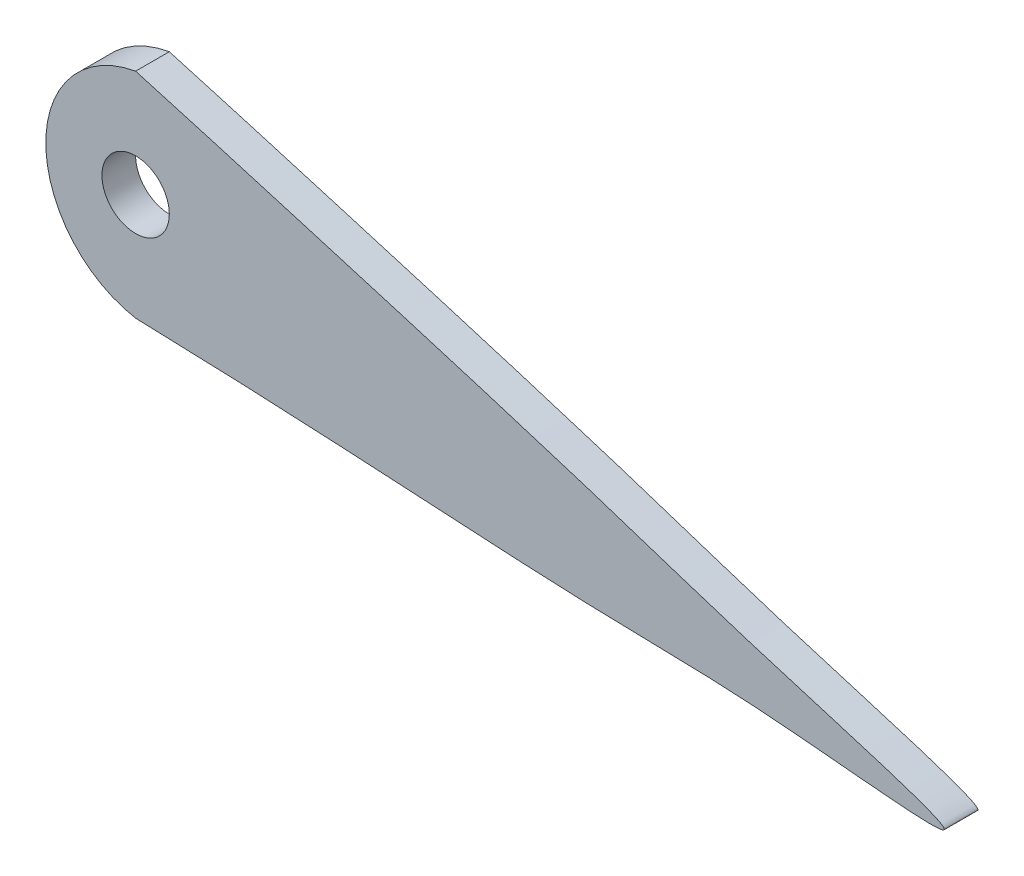
from build123d import *

# Parameters (mm, degrees)
SKETCH1_R                      = 9.525
SKETCH1_R_2                    = 3.175
BOSS_EXTRUDE1_DEPTH            = 3.175
CUT_EXTRUDE1_DEPTH             = 83.312
CUT_EXTRUDE2_DEPTH             = 41.720661094
CUT_EXTRUDE3_DEPTH             = 41.720661094
CUT_EXTRUDE5_DEPTH             = 3.175
BODY_DELETE_KEEP_1_OUTLINE_R   = 9.525
BODY_DELETE_KEEP_1_OUTLINE_R_2 = 3.175
BODY_DELETE_KEEP_1_DEPTH       = 3.175
CUT_EXTRUDE_THIN1_DEPTH        = 306.750045716
CUT_EXTRUDE_THIN1_DEPTH_BACK   = 306.750045716
SKETCH5_W                      = 2.54
SKETCH5_H                      = 35.939370043


# Read off the part's stored shape, not the designer's step: Cut-Extrude5, Body-Delete/Keep 1
with BuildPart() as part:
    # Sketch1 → Boss-Extrude1 (new body)
    with BuildSketch(Plane.XY):
        with BuildLine():
            add(Edge.make_bspline(
                [(304.8, 0), (305.077640245, 0.670235949), (287.206651558, 5.720143468), (270.662795429, 11.397054489), (243.463273842, 19.4859206), (213.747912645, 28.209957225), (183.040246216, 34.676594881), (152.491946525, 38.62898995), (121.966980877, 41.172895409), (91.414928066, 41.723012749), (65.927495496, 40.062013506), (45.625003822, 37.00459991), (32.727710355, 34.352142796), (22.731795616, 30.196529044), (14.907225707, 26.461250588), (8.516283527, 21.964417846), (2.537455581, 16.488464455), (-1.964479894, 8.893906893), (2.841930098, 2.334923028), (8.778829491, 0.629027732), (15.228793663, 0.221834685), (22.863576464, 0.239109806), (33.015631673, 0.788100742), (45.740419078, 0.855312608), (66.018396979, 2.65839435), (91.426578086, 3.794926314), (121.91527013, 4.332217391), (152.40834867, 4.479066808), (182.849810214, 4.269103649), (213.479164171, 4.047670271), (243.430144592, 3.313971789), (270.486497521, 1.370513613), (287.394329759, 1.442404027), (304.536665057, -0.635702313), (304.8, 0)],
                knots=[0, 0, 0, 0, 0.025556044, 0.050960447, 0.101552747, 0.151805438, 0.201252492, 0.250083002, 0.298629141, 0.347026117, 0.395536064, 0.420002519, 0.444885368, 0.457915187, 0.471441031, 0.48620838, 0.494593531, 0.510948222, 0.521394631, 0.527823606, 0.539981828, 0.552079711, 0.564187269, 0.588393921, 0.612648894, 0.661100879, 0.709502089, 0.757894227, 0.806286364, 0.854680317, 0.903093621, 0.951545605, 0.97576072, 1, 1, 1, 1], degree=3))
        make_face()
        with Locations((82.55, 21.412200012)):
            Circle(SKETCH1_R, mode=Mode.SUBTRACT)
        with Locations((152.4, 21.412200012)):
            Circle(SKETCH1_R_2, mode=Mode.SUBTRACT)
        with Locations((228.6, 13.713637845)):
            Circle(SKETCH1_R_2, mode=Mode.SUBTRACT)
    extrude(amount=BOSS_EXTRUDE1_DEPTH)

    # Sketch2 → Cut-Extrude1 (cut)
    with BuildSketch(Plane.XY.offset(3.175)):
        with BuildLine():
            Line((107.95, 32.461200012), (133.35, 32.461200012))
            ThreePointArc((133.35, 32.461200012), (144.399, 21.412200012), (133.35, 10.363200012))
            Line((133.35, 10.363200012), (107.95, 10.363200012))
            ThreePointArc((107.95, 10.363200012), (96.901, 21.412200012), (107.95, 32.461200012))
        make_face()
    extrude(amount=-CUT_EXTRUDE1_DEPTH, mode=Mode.SUBTRACT)

    # Sketch2<3> → Cut-Extrude2 (cut)
    with BuildSketch(Plane.XY.offset(3.175)):
        with BuildLine():
            Line((54.120617908, 7.858599468), (19.13723729, 7.396211684))
            ThreePointArc((19.13723729, 7.396211684), (12.206581412, 13.227292952), (16.97145499, 20.929985952))
            Line((16.97145499, 20.929985952), (50.35209489, 31.407752975))
            ThreePointArc((50.35209489, 31.407752975), (65.861602224, 21.813596528), (54.120617908, 7.858599468))
        make_face()
    extrude(amount=-CUT_EXTRUDE2_DEPTH, mode=Mode.SUBTRACT)

    # Sketch2<4> → Cut-Extrude3 (cut)
    with BuildSketch(Plane.XY.offset(3.175)):
        with BuildLine():
            Line((177.575712719, 31.649714976), (211.50265303, 23.10492457))
            ThreePointArc((211.50265303, 23.10492457), (217.464748261, 14.906681868), (210.11714063, 7.923099332))
            Line((210.11714063, 7.923099332), (175.164881599, 7.923099332))
            ThreePointArc((175.164881599, 7.923099332), (162.64237396, 21.181283902), (177.575712719, 31.649714976))
        make_face()
    extrude(amount=-CUT_EXTRUDE3_DEPTH, mode=Mode.SUBTRACT)

    # Cut-Extrude5 outline → Cut-Extrude5 (cut)
    with BuildSketch(Plane.XY):
        with BuildLine():
            add(Edge.make_bspline(
                [(219.855455249, 3.846240006), (222.76607486, 3.787240674), (225.676636253, 3.717870705), (228.6, 3.633767698)],
                knots=[0.865078344, 0.865078344, 0.865078344, 0.865078344, 0.879068023, 0.879068023, 0.879068023, 0.879068023], degree=3))
            ThreePointArc((228.6, 3.633767698), (220.136164742, 13.713637845), (228.6, 23.793507992))
            add(Edge.make_bspline(
                [(228.6, 23.793507992), (225.681425259, 24.620808401), (222.771978735, 25.426534387), (219.855455249, 26.205464415)],
                knots=[0.126545277, 0.126545277, 0.126545277, 0.126545277, 0.141060167, 0.141060167, 0.141060167, 0.141060167], degree=3))
            Line((219.855455249, 26.205464415), (219.855455249, 3.846240006))
        make_face()
    extrude(amount=CUT_EXTRUDE5_DEPTH, mode=Mode.SUBTRACT)

    # Body-Delete/Keep 1 outline → Body-Delete/Keep 1 (cut)
    with BuildSketch(Plane.XY):
        with BuildLine():
            Line((219.855455249, 3.846240006), (219.855455249, 26.205464415))
            add(Edge.make_bspline(
                [(219.855455249, 26.205464415), (217.696373423, 26.782100836), (205.580009963, 29.93001196), (183.040246216, 34.676594881), (152.491946525, 38.62898995), (121.966980877, 41.172895409), (91.414928066, 41.723012749), (65.927495496, 40.062013506), (45.625003822, 37.00459991), (32.727710355, 34.352142796), (22.731795616, 30.196529044), (14.907225707, 26.461250588), (8.516283527, 21.964417846), (2.537455581, 16.488464455), (-1.964479894, 8.893906893), (2.841930098, 2.334923028), (8.778829491, 0.629027732), (15.228793663, 0.221834685), (22.863576464, 0.239109806), (33.015631673, 0.788100742), (45.740419078, 0.855312608), (66.018396979, 2.65839435), (91.426578086, 3.794926314), (121.91527013, 4.332217391), (152.40834867, 4.479066808), (182.849810214, 4.269103649), (205.459961583, 4.105644694), (217.692095889, 3.890092097), (219.855455249, 3.846240006)],
                knots=[0.141060167, 0.141060167, 0.141060167, 0.141060167, 0.151805438, 0.201252492, 0.250083002, 0.298629141, 0.347026117, 0.395536064, 0.420002519, 0.444885368, 0.457915187, 0.471441031, 0.48620838, 0.494593531, 0.510948222, 0.521394631, 0.527823606, 0.539981828, 0.552079711, 0.564187269, 0.588393921, 0.612648894, 0.661100879, 0.709502089, 0.757894227, 0.806286364, 0.854680317, 0.865078344, 0.865078344, 0.865078344, 0.865078344], degree=3))
        make_face()
        with BuildLine():
            ThreePointArc((19.13723729, 7.396211684), (12.206581412, 13.227292952), (16.97145499, 20.929985952))
            Line((16.97145499, 20.929985952), (50.35209489, 31.407752975))
            ThreePointArc((50.35209489, 31.407752975), (65.861602224, 21.813596528), (54.120617908, 7.858599468))
            Line((54.120617908, 7.858599468), (19.13723729, 7.396211684))
        make_face(mode=Mode.SUBTRACT)
        with BuildLine():
            ThreePointArc((175.164881599, 7.923099332), (162.64237396, 21.181283902), (177.575712719, 31.649714976))
            Line((177.575712719, 31.649714976), (211.50265303, 23.10492457))
            ThreePointArc((211.50265303, 23.10492457), (217.464748261, 14.906681868), (210.11714063, 7.923099332))
            Line((210.11714063, 7.923099332), (175.164881599, 7.923099332))
        make_face(mode=Mode.SUBTRACT)
        with Locations((82.55, 21.412200012)):
            Circle(BODY_DELETE_KEEP_1_OUTLINE_R, mode=Mode.SUBTRACT)
        with BuildLine():
            ThreePointArc((107.95, 10.363200012), (96.901, 21.412200012), (107.95, 32.461200012))
            Line((107.95, 32.461200012), (133.35, 32.461200012))
            ThreePointArc((133.35, 32.461200012), (144.399, 21.412200012), (133.35, 10.363200012))
            Line((133.35, 10.363200012), (107.95, 10.363200012))
        make_face(mode=Mode.SUBTRACT)
        with Locations((152.4, 21.412200012)):
            Circle(BODY_DELETE_KEEP_1_OUTLINE_R_2, mode=Mode.SUBTRACT)
    extrude(amount=BODY_DELETE_KEEP_1_DEPTH, mode=Mode.SUBTRACT)

    # Sketch5 → Cut-Extrude-Thin1 (cut, two sides: drawn at the far end of the back side and taken through both)
    with BuildSketch(Plane.XY.offset(3.175).offset(-CUT_EXTRUDE_THIN1_DEPTH_BACK)):
        with Locations((218.885261275, 9.319373198)):
            Rectangle(SKETCH5_W, SKETCH5_H)
        with BuildLine():
            ThreePointArc((220.155261275, 14.338544909), (220.136164742, 13.713637845), (220.155261275, 13.088730781))
            Line((220.155261275, 13.088730781), (217.62000082, 12.933635906))
            ThreePointArc((217.62000082, 12.933635906), (217.596164742, 13.713637845), (217.62000082, 14.493639785))
            Line((217.62000082, 14.493639785), (220.155261275, 14.338544909))
        make_face()
    extrude(amount=CUT_EXTRUDE_THIN1_DEPTH + CUT_EXTRUDE_THIN1_DEPTH_BACK, mode=Mode.SUBTRACT)


solid = part.part
